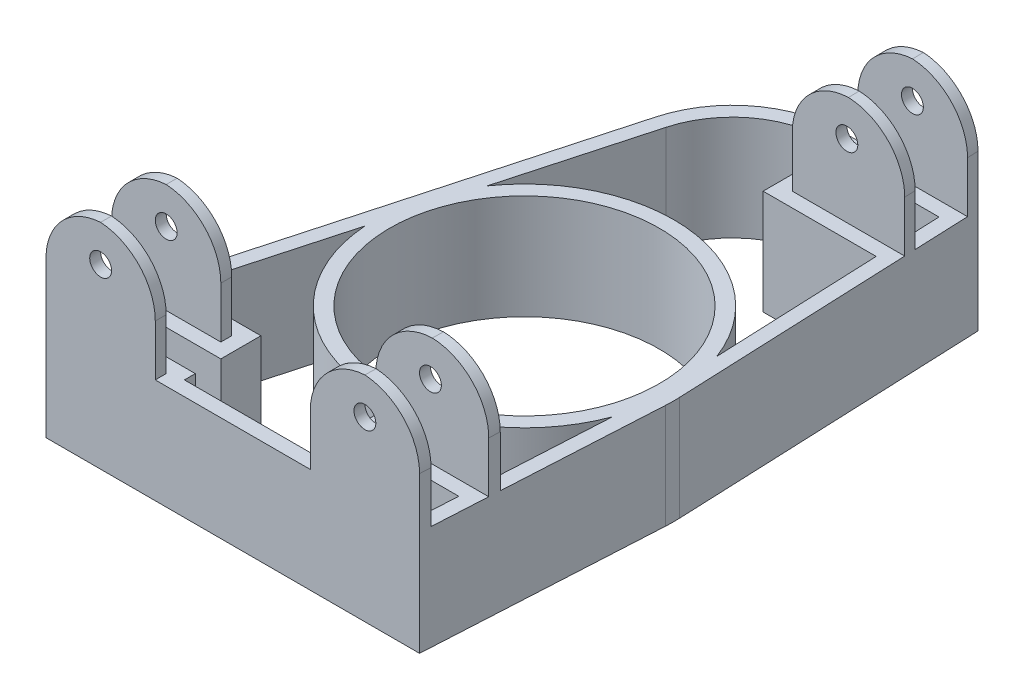
from build123d import *

# Parameters (mm, degrees)
SKETCH1_R            = 47
BASE_DEPTH           = 36.5
SKETCH2_W            = 38.1
SKETCH2_H            = 3.81
A_ARMS_DEPTH         = 38.1
FILLET_A_ARM_TAB_F_R = 20.32
FILLET2_R            = 50.8
SKETCH3_R            = 3.937
BOSS_EXTRUDE3_DEPTH  = 10
FILLET3_R            = 12.7
SKETCH6_R            = 3.81
TAB_HOLES_1_DEPTH    = 224.393667494
SKETCH7_R            = 3.81
TAB_HOLES_2_DEPTH    = 201.571915927
CUT_EXTRUDE2_DEPTH   = 154.791870017


with BuildPart() as part:
    # Sketch1 → Base (new body)
    with BuildSketch(Plane(origin=(0, 0, 0), x_dir=(1, 0, 0), z_dir=(0, 1, 0))):
        with BuildLine():
            Line((-80.129262367, -86.715777422), (50.125302211, -86.715777422))
            Line((50.125302211, -86.715777422), (54.750608495, -2.975412689))
            Line((54.750608495, -2.975412689), (50.125302211, 108.014745968))
            Line((50.125302211, 108.014745968), (2.575336515, 108.014745968))
            ThreePointArc((2.575336515, 108.014745968), (-20.509235608, 100.225016997), (-34.154303257, 80.041125489))
            Line((-34.154303257, 80.041125489), (-72.776330416, -60.045777422))
            Line((-72.776330416, -60.045777422), (-80.129262367, -60.045777422))
            Line((-80.129262367, -60.045777422), (-80.129262367, -86.715777422))
        make_face()
        with Locations(Location((0, 0, 0), (0, 0, 270))):
            Circle(SKETCH1_R, mode=Mode.SUBTRACT)
    extrude(amount=BASE_DEPTH)

    # Sketch2 → A-Arms (add)
    with BuildSketch(Plane(origin=(0, 36.5, 0), x_dir=(1, 0, 0), z_dir=(0, 1, 0))):
        Polygon((50.125302211, 108.014745968), (50.284076801, 104.204745968), (12.025302211, 104.204745968), (12.025302211, 108.014745968), align=None)
        Polygon((12.025302211, -82.905777422), (50.335743341, -82.905777422), (50.125302211, -86.715777422), (12.025302211, -86.715777422), align=None)
        Polygon((12.025302211, 85.154745968), (12.025302211, 81.344745968), (51.236724342, 81.344745968), (51.077949751, 85.154745968), align=None)
        Polygon((12.025302211, -60.045777422), (51.598390118, -60.045777422), (51.387948988, -63.855777422), (12.025302211, -63.855777422), align=None)
        with Locations((-61.079262367, -61.950777422)):
            Rectangle(SKETCH2_W, SKETCH2_H)
        with Locations((-61.079262367, -84.810777422)):
            Rectangle(SKETCH2_W, SKETCH2_H)
    extrude(amount=A_ARMS_DEPTH)

    # Fillet a-arm tab f
    # the kernel refuses this fillet: 20.32 mm, written as the material it takes off along each edge
    with BuildSketch(Plane(origin=(53.137354768, 74.6, 32.183090452), x_dir=(0, -1, 0), z_dir=(-0.055149831244914994, 0, 0.9984780899517313)), Plane(origin=(54.400001545, 74.6, 9.323090452), x_dir=(0, -1, 0), z_dir=(-0.055149831244913544, 0, 0.9984780899517313))) as fillet_a_arm_tab_f_piece_1:
        with BuildLine():
            CenterArc((FILLET_A_ARM_TAB_F_R, -FILLET_A_ARM_TAB_F_R), FILLET_A_ARM_TAB_F_R, 90, 90)
            Line((0, -FILLET_A_ARM_TAB_F_R), (0, 0))
            Line((0, 0), (FILLET_A_ARM_TAB_F_R, 0))
        make_face()
    extrude(amount=105.415807315, mode=Mode.SUBTRACT)
    with BuildSketch(Plane(origin=(12.025302211, 74.6, 137.515777422), x_dir=(1, 0, 0), z_dir=(0, 0, -1)), Plane(origin=(12.025302211, 74.6, -135.954745968), x_dir=(0, -1, 0), z_dir=(0, 0, 1)), Plane(origin=(-80.129262367, 74.6, 137.515777422), x_dir=(1, 0, 0), z_dir=(0, 0, -1))) as fillet_a_arm_tab_f_piece_2:
        with BuildLine():
            CenterArc((FILLET_A_ARM_TAB_F_R, FILLET_A_ARM_TAB_F_R), FILLET_A_ARM_TAB_F_R, 180, 90)
            Line((0, FILLET_A_ARM_TAB_F_R), (0, 0))
            Line((0, 0), (FILLET_A_ARM_TAB_F_R, 0))
        make_face()
    extrude(amount=105.41, mode=Mode.SUBTRACT)
    with BuildSketch(Plane(origin=(12.025302211, 74.6, 114.655777422), x_dir=(0, -1, 0), z_dir=(0, 0, -1)), Plane(origin=(12.025302211, 74.6, -53.404745968), x_dir=(0, -1, 0), z_dir=(0, 0, -1)), Plane(origin=(-42.029262367, 74.6, 32.105777422), x_dir=(0, -1, 0), z_dir=(0, 0, 1)), Plane(origin=(-42.029262367, 74.6, 114.655777422), x_dir=(-1, 0, 0), z_dir=(0, 0, -1)), Plane(origin=(-80.129262367, 74.6, 9.245777422), x_dir=(1, 0, 0), z_dir=(0, 0, 1))) as fillet_a_arm_tab_f_piece_3:
        with BuildLine():
            CenterArc((FILLET_A_ARM_TAB_F_R, -FILLET_A_ARM_TAB_F_R), FILLET_A_ARM_TAB_F_R, 90, 90)
            Line((0, -FILLET_A_ARM_TAB_F_R), (0, 0))
            Line((0, 0), (FILLET_A_ARM_TAB_F_R, 0))
        make_face()
    extrude(amount=105.41, mode=Mode.SUBTRACT)
    with BuildSketch(Plane(origin=(53.351883028, 74.6, -30.588799481), x_dir=(0, -1, 0), z_dir=(-0.04163698201983484, 0, -0.9991328048504263)), Plane(origin=(48.010143525, 74.6, -158.770692454), x_dir=(-0.9991328048504262, 0, 0.04163698201983669), z_dir=(0.0416369820198367, 0, 0.9991328048504262))) as fillet_a_arm_tab_f_piece_4:
        with BuildLine():
            CenterArc((FILLET_A_ARM_TAB_F_R, FILLET_A_ARM_TAB_F_R), FILLET_A_ARM_TAB_F_R, 180, 90)
            Line((0, FILLET_A_ARM_TAB_F_R), (0, 0))
            Line((0, 0), (FILLET_A_ARM_TAB_F_R, 0))
        make_face()
    extrude(amount=105.413306881, mode=Mode.SUBTRACT)

    # Fillet2
    # the kernel refuses this fillet: 50.8 mm, written as the material it takes off along each edge
    with BuildSketch(Plane(origin=(54.750608495, -6.153313098, 2.975412689), x_dir=(-0.05514983124491408, 0, 0.9984780899517313), z_dir=(0, 1, 0))) as fillet2_piece_1:
        with BuildLine():
            CenterArc((FILLET2_R * 0.0484512842399, -FILLET2_R), FILLET2_R, 90, 5.547769732)
            Line((-FILLET2_R * 0.0482243356174, -FILLET2_R * 0.00468405793677), (0, 0))
            Line((0, 0), (FILLET2_R * 0.0484512842399, 0))
        make_face()
    extrude(amount=48.806626197, mode=Mode.SUBTRACT)

    # Sketch3 → Boss-Extrude3 (add)
    with BuildSketch(Plane(origin=(0, 1, 0), x_dir=(-1, 0, 0), z_dir=(0, -1, 0))):
        with BuildLine():
            Line((42.093323872, 51.245308907), (62.210800727, -21.723285296))
            Line((62.210800727, -21.723285296), (72.188506448, -18.972426984))
            ThreePointArc((72.188506448, -18.972426984), (77.618129068, -10.048878041), (69.039031874, -4.089883254))
            ThreePointArc((69.039031874, -4.089883254), (65.518990894, -3.323443269), (63.392280792, -0.415656673))
            Line((63.392280792, -0.415656673), (54.014483076, 33.598783658))
            ThreePointArc((54.014483076, 33.598783658), (54.320283062, 37.122596493), (56.852004495, 39.592648541))
            ThreePointArc((56.852004495, 39.592648541), (60.937845875, 49.122693965), (51.737082765, 53.904097917))
            Line((51.737082765, 53.904097917), (42.093323872, 51.245308907))
        make_face()
        with Locations(Location((70.163230544, -11.62649903, 0), (0, 0, 90))):
            Circle(SKETCH3_R, mode=Mode.SUBTRACT)
        with Locations(Location((53.76235867, 46.558169963, 0), (0, 0, 90))):
            Circle(SKETCH3_R, mode=Mode.SUBTRACT)
    extrude(amount=-BOSS_EXTRUDE3_DEPTH)

    # Fillet3
    # the kernel refuses this fillet: 12.7 mm, written as the material it adds along each edge
    with BuildSketch(Plane(origin=(-42.093323872, 1, -51.245308907), x_dir=(0.26578423939908447, 0, -0.9640325399523867), z_dir=(0, 1, 0))) as fillet3_piece_1:
        with BuildLine():
            CenterArc((12.520298407, 12.7), FILLET3_R, 187.62557017, 82.37442983)
            Line((-0.067388097, 11.014725997), (-1.326156748, 10.846198597))
            ThreePointArc((-1.326156748, 10.846198597), (-1.27, 10.003561596), (-1.27, 0))
            Line((-1.27, 0), (0, -1.27))
            Line((0, -1.27), (12.520298407, -1.27))
            Line((12.520298407, -1.27), (12.520298407, 0))
        make_face()
    extrude(amount=10)
    with BuildSketch(Plane(origin=(-62.210800727, 1, 21.723285296), x_dir=(-0.26578423939908535, 0, 0.9640325399523866), z_dir=(0, 1, 0))) as fillet3_piece_2:
        with BuildLine():
            CenterArc((12.563650525, -12.7), FILLET3_R, 90, 83.358813764)
            Line((-0.051131053, -11.231229858), (-1.312609211, -11.084352844))
            ThreePointArc((-1.312609211, -11.084352844), (-1.27, -10.349967773), (-1.27, 0))
            Line((-1.27, 0), (0, 1.27))
            Line((0, 1.27), (12.563650525, 1.27))
            Line((12.563650525, 1.27), (12.563650525, 0))
        make_face()
    extrude(amount=10)

    # Sketch6 → Tab Holes 1 (cut, through all)
    with BuildSketch(Plane(origin=(0, 0, -108.014745968), x_dir=(-1, 0, 0), z_dir=(0, 0, -1))):
        with Locations((-31.067038594, 61.859754489)):
            Circle(SKETCH6_R)
    extrude(amount=-TAB_HOLES_1_DEPTH, mode=Mode.SUBTRACT)

    # Sketch7 → Tab Holes 2 (cut, through all)
    with BuildSketch(Plane(origin=(0, 0, 60.045777422), x_dir=(-1, 0, 0), z_dir=(0, 0, -1))):
        with Locations((61.079262367, 61.860273667)):
            Circle(SKETCH7_R)
    extrude(amount=-TAB_HOLES_2_DEPTH, mode=Mode.SUBTRACT)

    # Sketch8 → Cut-Extrude2 (cut, through all)
    with BuildSketch(Plane(origin=(0, 0, 0), x_dir=(1, 0, 0), z_dir=(0, 1, 0))):
        with BuildLine():
            Line((-29.257017954, 78.690941553), (-42.752390199, 29.741545559))
            ThreePointArc((-42.752390199, 29.741545559), (6.494009323, 51.673535228), (48.782168121, 18.238050153))
            Line((48.782168121, 18.238050153), (46.36401462, 76.264745968))
            Line((46.36401462, 76.264745968), (6.945302211, 76.264745968))
            Line((6.945302211, 76.264745968), (6.945302211, 90.234745968))
            Line((6.945302211, 90.234745968), (45.781841123, 90.234745968))
            Line((45.781841123, 90.234745968), (45.41136708, 99.124745968))
            Line((45.41136708, 99.124745968), (6.945302211, 99.124745968))
            Line((6.945302211, 99.124745968), (6.945302211, 102.934745968))
            Line((6.945302211, 102.934745968), (2.575336515, 102.934745968))
            ThreePointArc((2.575336515, 102.934745968), (-17.431292658, 96.183647526), (-29.257017954, 78.690941553))
        make_face()
        with BuildLine():
            Line((-75.049262367, -77.825777422), (-36.949262367, -77.825777422))
            Line((-36.949262367, -77.825777422), (-36.949262367, -81.635777422))
            Line((-36.949262367, -81.635777422), (6.945302211, -81.635777422))
            Line((6.945302211, -81.635777422), (6.945302211, -77.825777422))
            Line((6.945302211, -77.825777422), (45.528588426, -77.825777422))
            Line((45.528588426, -77.825777422), (46.019617728, -68.935777422))
            Line((46.019617728, -68.935777422), (6.945302211, -68.935777422))
            Line((6.945302211, -68.935777422), (6.945302211, -54.965777422))
            Line((6.945302211, -54.965777422), (46.791235203, -54.965777422))
            Line((46.791235203, -54.965777422), (48.826411186, -18.119270701))
            ThreePointArc((48.826411186, -18.119270701), (-7.410849482, -51.550031134), (-51.953259135, -3.631152049))
            Line((-51.953259135, -3.631152049), (-66.106240279, -54.965777422))
            Line((-66.106240279, -54.965777422), (-36.949262367, -54.965777422))
            Line((-36.949262367, -54.965777422), (-36.949262367, -68.935777422))
            Line((-36.949262367, -68.935777422), (-75.049262367, -68.935777422))
            Line((-75.049262367, -68.935777422), (-75.049262367, -77.825777422))
        make_face()
    extrude(amount=CUT_EXTRUDE2_DEPTH, mode=Mode.SUBTRACT)


solid = part.part
